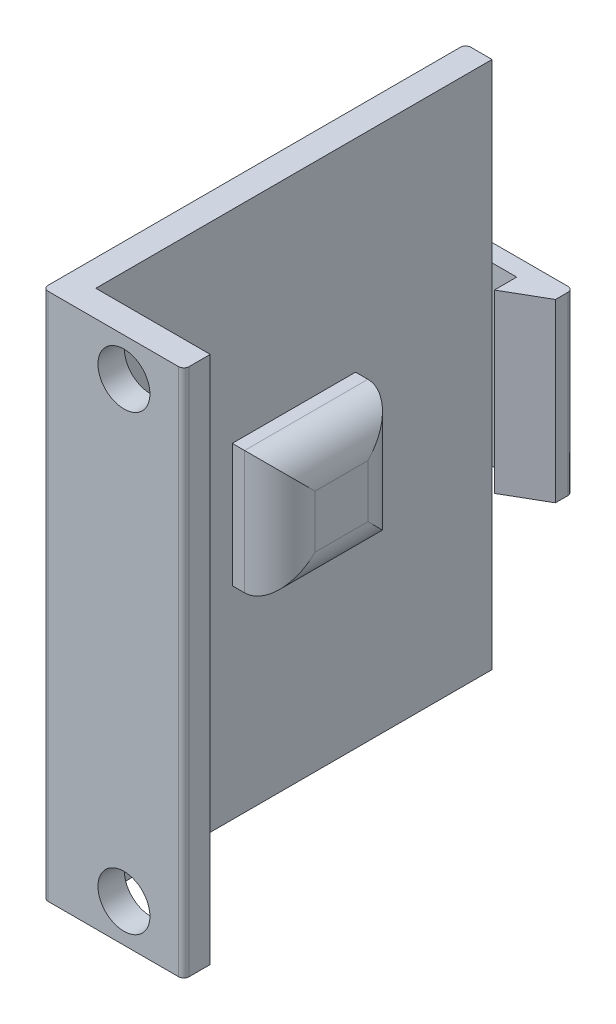
from build123d import *

# Parameters (mm, degrees)
BOSS_EXTRUDE1_DEPTH      = 5
BOSS_EXTRUDE1_DEPTH_BACK = 5
SKETCH2_W                = 3.6
SKETCH2_H                = 10
BOSS_EXTRUDE2_DEPTH      = 1
BOSS_EXTRUDE3_DEPTH      = 1.5
SKETCH4_W                = 8
SKETCH4_H                = 30
SKETCH4_R                = 1.475
BOSS_EXTRUDE4_DEPTH      = 1.5
FILLET1_R                = 0.3
SKETCH5_W                = 7
SKETCH5_H                = 7
BOSS_EXTRUDE5_DEPTH      = 2.7
FILLET2_R                = 2


with BuildPart() as part:
    # Sketch1 → Boss-Extrude1 (new, two sides: drawn at the far end of the back side and taken through both)
    with BuildSketch(Plane(origin=(0, 0, 0), x_dir=(1, 0, 0), z_dir=(0, 1, 0)).offset(-BOSS_EXTRUDE1_DEPTH_BACK)):
        Polygon((0, 0), (-2.2, 0), (-2.2, -1.270170592), align=None)
    extrude(amount=BOSS_EXTRUDE1_DEPTH + BOSS_EXTRUDE1_DEPTH_BACK)

    # Sketch2 → Boss-Extrude2 (add)
    with BuildSketch(Plane(origin=(0, 0, 0), x_dir=(-1, 0, 0), z_dir=(0, 0, -1))):
        with Locations((1.8, 0)):
            Rectangle(SKETCH2_W, SKETCH2_H)
    extrude(amount=BOSS_EXTRUDE2_DEPTH)

    # Sketch3 → Boss-Extrude3 (add)
    with BuildSketch(Plane.ZY.offset(3.6)):
        Polygon((0, -5), (0, -15), (22.5, -15), (22.5, 15), (0, 15), (0, 5), (-1, 5), (-1, -5), align=None)
    extrude(amount=BOSS_EXTRUDE3_DEPTH)

    # Sketch4 → Boss-Extrude4 (add)
    with BuildSketch(Plane.XY.offset(22.5)):
        with Locations((-1.1, 0)):
            Rectangle(SKETCH4_W, SKETCH4_H)
        with Locations((-0.5, 12.84)):
            Circle(SKETCH4_R, mode=Mode.SUBTRACT)
        with Locations((-0.5, -12.84)):
            Circle(SKETCH4_R, mode=Mode.SUBTRACT)
    extrude(amount=BOSS_EXTRUDE4_DEPTH)

    # Fillet1
    fillet1_edges = [part.edges().sort_by_distance(p)[0] for p in [
        (-5.1, 0, -1),
        (-5.1, 0, 24),
        (-5.1, -10, 0),
        (-5.1, 10, 0),
        (2.9, 0, 24),
        (0, 0, -1),
    ]]
    fillet(fillet1_edges, radius=FILLET1_R)

    # Sketch5 → Boss-Extrude5 (add)
    with BuildSketch(Plane(origin=(-3.6, 0, 0), x_dir=(0, 0, -1), z_dir=(1, 0, 0))):
        with Locations((-11.25, 0)):
            Rectangle(SKETCH5_W, SKETCH5_H)
    extrude(amount=BOSS_EXTRUDE5_DEPTH)

    # Fillet2
    fillet2_edges = [part.edges().sort_by_distance(p)[0] for p in [
        (-0.9, 0, 14.75),
        (-0.9, 3.5, 11.25),
        (-0.9, 0, 7.75),
        (-0.9, -3.5, 11.25),
    ]]
    fillet(fillet2_edges, radius=FILLET2_R)


solid = part.part
